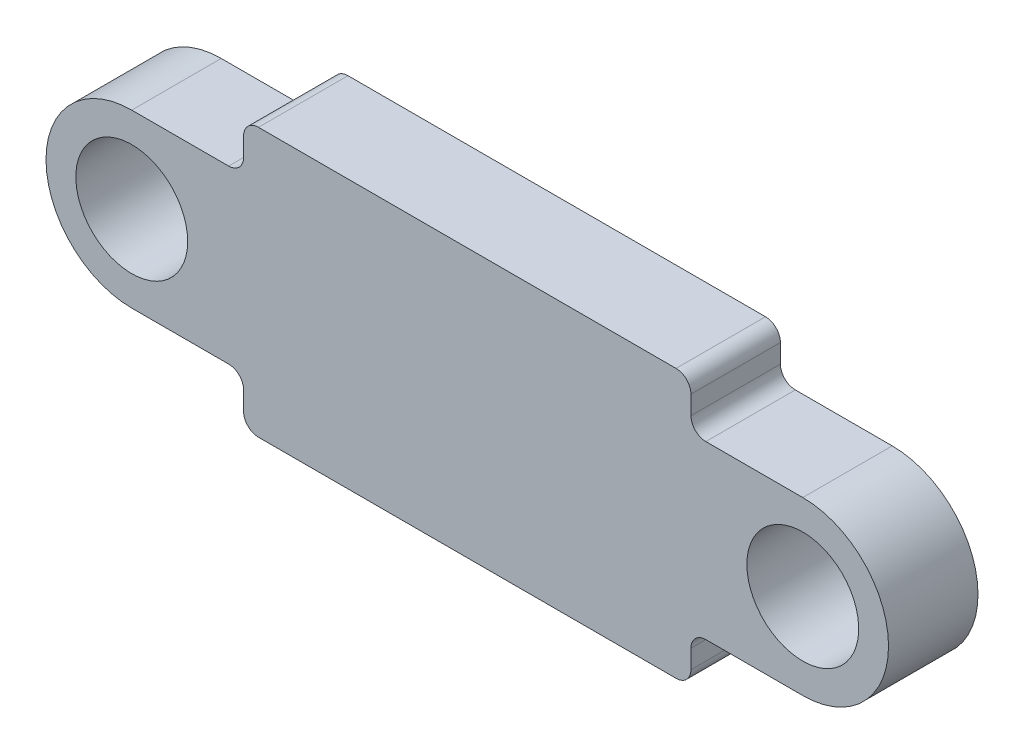
from build123d import *

# Parameters (mm, degrees)
SKETCH1_R           = 7.5
BOSS_EXTRUDE1_DEPTH = 12


with BuildPart() as part:
    # Sketch1 → Boss-Extrude1 (new body)
    with BuildSketch(Plane.XY):
        with BuildLine():
            Line((-45, 11.5), (-32, 11.5))
            ThreePointArc((-32, 11.5), (-30.585786438, 12.085786438), (-30, 13.5))
            Line((-30, 13.5), (-30, 16))
            ThreePointArc((-30, 16), (-29.414213562, 17.414213562), (-28, 18))
            Line((-28, 18), (28, 18))
            ThreePointArc((28, 18), (29.414213562, 17.414213562), (30, 16))
            Line((30, 16), (30, 13.5))
            ThreePointArc((30, 13.5), (30.585786438, 12.085786438), (32, 11.5))
            Line((32, 11.5), (45, 11.5))
            ThreePointArc((45, 11.5), (56.5, 0), (45, -11.5))
            Line((45, -11.5), (32, -11.5))
            ThreePointArc((32, -11.5), (30.585786438, -12.085786438), (30, -13.5))
            Line((30, -13.5), (30, -16))
            ThreePointArc((30, -16), (29.414213562, -17.414213562), (28, -18))
            Line((28, -18), (-28, -18))
            ThreePointArc((-28, -18), (-29.414213562, -17.414213562), (-30, -16))
            Line((-30, -16), (-30, -13.5))
            ThreePointArc((-30, -13.5), (-30.585786438, -12.085786438), (-32, -11.5))
            Line((-32, -11.5), (-45, -11.5))
            ThreePointArc((-45, -11.5), (-56.5, 0), (-45, 11.5))
        make_face()
        with Locations((-45, 0)):
            Circle(SKETCH1_R, mode=Mode.SUBTRACT)
        with Locations((45, 0)):
            Circle(SKETCH1_R, mode=Mode.SUBTRACT)
    extrude(amount=BOSS_EXTRUDE1_DEPTH)


solid = part.part
